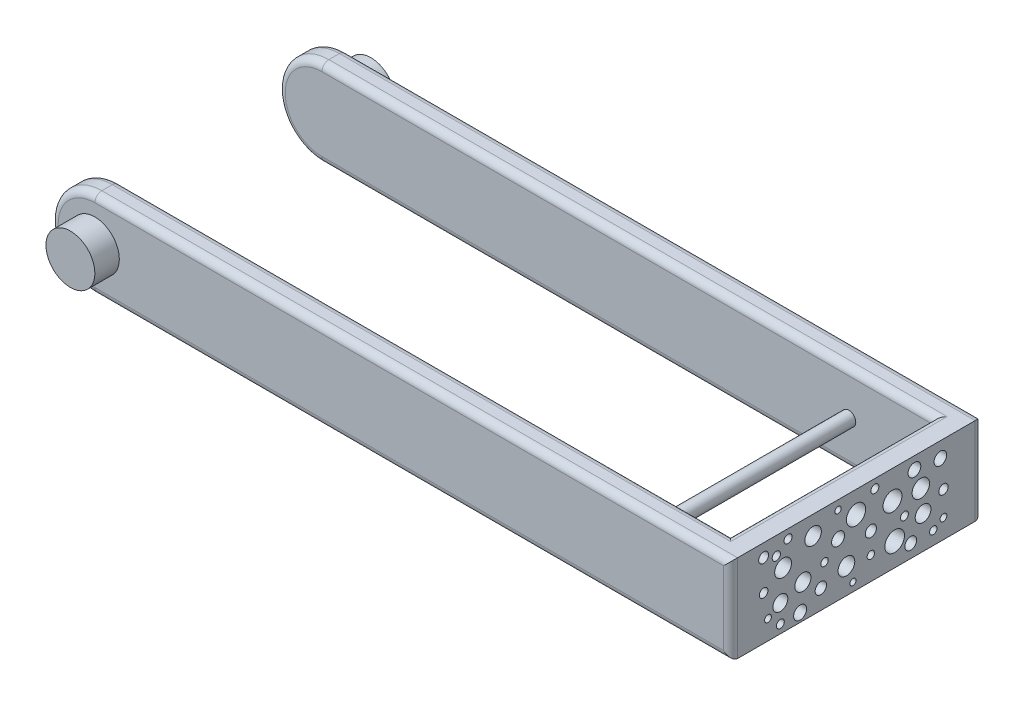
from build123d import *

# Parameters (mm, degrees)
BOSS_EXTRUDE1_DEPTH = 7
BOSS_EXTRUDE2_DEPTH = 7
SKETCH4_R           = 7
BOSS_EXTRUDE3_DEPTH = 7
SKETCH5_R           = 7
BOSS_EXTRUDE4_DEPTH = 7
SKETCH6_W           = 15.675123076
SKETCH6_H           = 25
CUT_EXTRUDE1_DEPTH  = 129.051747352
SKETCH7_W           = 72
SKETCH7_H           = 25
BOSS_EXTRUDE5_DEPTH = 7
SKETCH8_R           = 1.061370883
SKETCH8_R_2         = 1.592056325
SKETCH8_R_3         = 2.707420536
SKETCH8_R_4         = 2.754684025
SKETCH8_R_5         = 2.368943822
SKETCH8_R_6         = 2.299636914
SKETCH8_R_7         = 2.392474711
SKETCH8_R_8         = 2.815079383
SKETCH8_R_9         = 1.134575484
SKETCH8_R_10        = 1.630892674
SKETCH8_R_11        = 2.410638363
SKETCH8_R_12        = 2.139261407
SKETCH8_R_13        = 1.839257189
SKETCH8_R_14        = 1.824177684
SKETCH8_R_15        = 2.496489188
SKETCH8_R_16        = 2.252823118
SKETCH8_R_17        = 1.347918968
SKETCH8_R_18        = 1.149818457
SKETCH8_R_19        = 0.901675203
SKETCH8_R_20        = 0.884475736
SKETCH8_R_21        = 1.857399046
SKETCH8_R_22        = 1.699022407
SKETCH8_R_23        = 1.809875359
SKETCH8_R_24        = 0.975433155
SKETCH8_R_25        = 1.238266031
SKETCH8_R_26        = 1.426174271
SKETCH8_R_27        = 1.185528831
SKETCH8_R_28        = 1.125753823
CUT_EXTRUDE2_DEPTH  = 7
FILLET1_R           = 2
SKETCH9_R           = 2
BOSS_EXTRUDE6_DEPTH = 68


with BuildPart() as part:
    # Sketch1 → Boss-Extrude1 (new body)
    with BuildSketch(Plane.XY):
        with BuildLine():
            Line((-87.5, 12.5), (87.5, 12.5))
            ThreePointArc((87.5, 12.5), (100, 0), (87.5, -12.5))
            Line((87.5, -12.5), (-87.5, -12.5))
            ThreePointArc((-87.5, -12.5), (-100, 0), (-87.5, 12.5))
        make_face()
    extrude(amount=BOSS_EXTRUDE1_DEPTH)

    # Sketch5 → Boss-Extrude4 (add)
    with BuildSketch(Plane(origin=(0, 0, 0), x_dir=(-1, 0, 0), z_dir=(0, 0, -1))):
        with Locations(Location((87.5, 0, 0), (0, 0, 180))):
            Circle(SKETCH5_R)
    extrude(amount=BOSS_EXTRUDE4_DEPTH)


with BuildPart() as body_2:
    # Sketch3 → Boss-Extrude2 (new body)
    with BuildSketch(Plane.XY.offset(65)):
        with BuildLine():
            Line((-87.5, 12.5), (87.5, 12.5))
            ThreePointArc((87.5, 12.5), (100, 0), (87.5, -12.5))
            Line((87.5, -12.5), (-87.5, -12.5))
            ThreePointArc((-87.5, -12.5), (-100, 0), (-87.5, 12.5))
        make_face()
    extrude(amount=BOSS_EXTRUDE2_DEPTH)

    # Sketch4 → Boss-Extrude3 (add)
    with BuildSketch(Plane.XY.offset(72)):
        with Locations((-87.5, 0)):
            Circle(SKETCH4_R)
    extrude(amount=BOSS_EXTRUDE3_DEPTH)


with BuildPart() as cut_extrude1_tool:
    # Sketch6 → Cut-Extrude1 (new, through all)
    with BuildSketch(Plane.XY):
        with Locations((95.337561538, 0)):
            Rectangle(SKETCH6_W, SKETCH6_H)
    extrude(amount=CUT_EXTRUDE1_DEPTH)


with BuildPart() as part_1:
    add(part.part)

    # Cut-Extrude1: cut by cut_extrude1_tool
    add(cut_extrude1_tool.part, mode=Mode.SUBTRACT)



with BuildPart() as body_2_1:
    add(body_2.part)

    # Cut-Extrude1: cut by cut_extrude1_tool
    add(cut_extrude1_tool.part, mode=Mode.SUBTRACT)


with BuildPart() as part_2:
    add(part_1.part)

    add(body_2_1.part)  # Boss-Extrude5 merges body 2
    # Sketch7 → Boss-Extrude5 (add)
    with BuildSketch(Plane(origin=(87.5, 0, 0), x_dir=(0, 0, -1), z_dir=(1, 0, 0))):
        with Locations((-36, 0)):
            Rectangle(SKETCH7_W, SKETCH7_H)
    extrude(amount=BOSS_EXTRUDE5_DEPTH)

    # Sketch8 → Cut-Extrude2 (cut)
    with BuildSketch(Plane(origin=(94.5, 0, 0), x_dir=(0, 0, -1), z_dir=(1, 0, 0))):
        with Locations(Location((-45.110100082, -1.017147097, 0), (0, 0, 90))):
            Circle(SKETCH8_R)
        with Locations(Location((-31.84296404, 0.044223787, 0), (0, 0, 90))):
            Circle(SKETCH8_R_2)
        with Locations(Location((-25.651633888, 4.378154894, 0), (0, 0, 90))):
            Circle(SKETCH8_R_3)
        with Locations(Location((-36.088447574, 6.23555394, 0), (0, 0, 90))):
            Circle(SKETCH8_R_4)
        with Locations(Location((-48.382660305, 7.08557543, 0), (0, 0, 90))):
            Circle(SKETCH8_R_5)
        with Locations(Location((-51.301430235, -2.874546142, 0), (0, 0, 90))):
            Circle(SKETCH8_R_6)
        with Locations(Location((-38.843131599, -5.174183056, 0), (0, 0, 90))):
            Circle(SKETCH8_R_7)
        with Locations(Location((-25.032500872, -5.881763645, 0), (0, 0, 90))):
            Circle(SKETCH8_R_8)
        with Locations(Location((-22.21742149, -1.017147097, 0), (0, 0, 90))):
            Circle(SKETCH8_R_9)
        with Locations(Location((-31.84296404, -5.881763645, 0), (0, 0, 90))):
            Circle(SKETCH8_R)
        with Locations(Location((-46.171470965, -6.943134528, 0), (0, 0, 90))):
            Circle(SKETCH8_R_10)
        with Locations(Location((-56.962074946, 3.480869914, 0), (0, 0, 90))):
            Circle(SKETCH8_R_11)
        with Locations(Location((-57.758103108, -4.820392762, 0), (0, 0, 90))):
            Circle(SKETCH8_R_12)
        with Locations(Location((-41.23560631, 2.786098569, 0), (0, 0, 90))):
            Circle(SKETCH8_R_13)
        with Locations(Location((-19.371856161, 8.990237965, 0), (0, 0, 90))):
            Circle(SKETCH8_R_14)
        with Locations(Location((-17.547678478, 3.480869914, 0), (0, 0, 90))):
            Circle(SKETCH8_R_15)
        with Locations(Location((-16.8953241, -3.066684263, 0), (0, 0, 90))):
            Circle(SKETCH8_R_16)
        with Locations(Location((-13.976554171, -8.712086001, 0), (0, 0, 90))):
            Circle(SKETCH8_R)
        with Locations(Location((-11.057784242, 0, 0), (0, 0, 90))):
            Circle(SKETCH8_R_17)
        with Locations(Location((-30.693145583, 9.950352031, 0), (0, 0, 90))):
            Circle(SKETCH8_R_18)
        with Locations(Location((-41.23560631, 9.950352031, 0), (0, 0, 90))):
            Circle(SKETCH8_R_19)
        with Locations(Location((-55.546913768, 9.950352031, 0), (0, 0, 90))):
            Circle(SKETCH8_R_18)
        with Locations(Location((-36.97292331, -10.038799605, 0), (0, 0, 90))):
            Circle(SKETCH8_R_20)
        with Locations(Location((-52.097458397, -10.038799605, 0), (0, 0, 90))):
            Circle(SKETCH8_R_21)
        with Locations(Location((-20.433227045, -8.712086001, 0), (0, 0, 90))):
            Circle(SKETCH8_R_22)
        with Locations(Location((-11.942259978, 8.092952985, 0), (0, 0, 90))):
            Circle(SKETCH8_R_23)
        with Locations(Location((-11.057784242, -7.013063594, 0), (0, 0, 90))):
            Circle(SKETCH8_R_24)
        with Locations(Location((-62.534272083, 0.044223787, 0), (0, 0, 90))):
            Circle(SKETCH8_R_25)
        with Locations(Location((-61.296006052, -6.943134528, 0), (0, 0, 90))):
            Circle(SKETCH8_R_24)
        with Locations(Location((-62.534272083, 8.800533574, 0), (0, 0, 90))):
            Circle(SKETCH8_R_26)
        with Locations(Location((-58.907921565, 7.374359303, 0), (0, 0, 90))):
            Circle(SKETCH8_R_27)
        with Locations(Location((-57.758103108, -10.038799605, 0), (0, 0, 90))):
            Circle(SKETCH8_R_28)
    extrude(amount=-CUT_EXTRUDE2_DEPTH, mode=Mode.SUBTRACT)

    # Fillet1
    # the kernel refuses this fillet: 2 mm, written as the material it takes off along each edge
    with BuildSketch(Plane(origin=(-87.5, 12.5, 72), x_dir=(0, 0, -1), z_dir=(1, 0, 0)), Plane(origin=(99.5, -12.5, 0), x_dir=(0, 1, 0), z_dir=(-1, 0, 0)), Plane(origin=(99.5, 12.5, 0), x_dir=(0, 0, 1), z_dir=(-1, 0, 0)), Plane(origin=(-87.5, -12.5, 72), x_dir=(0, 1, 0), z_dir=(1, 0, 0))) as fillet1_piece_1:
        with BuildLine():
            CenterArc((FILLET1_R, -FILLET1_R), FILLET1_R, 90, 90)
            Line((0, -FILLET1_R), (0, 0))
            Line((0, 0), (FILLET1_R, 0))
        make_face()
    extrude(amount=187, mode=Mode.SUBTRACT)
    with BuildSketch(Plane(origin=(87.5, -12.5, 7), x_dir=(0, 1, 0), z_dir=(0, 0, 1))) as fillet1_piece_2:
        with BuildLine():
            CenterArc((FILLET1_R, -FILLET1_R), FILLET1_R, 90, 90)
            Line((0, -FILLET1_R), (0, 0))
            Line((0, 0), (FILLET1_R, 0))
        make_face()
    extrude(amount=58, mode=Mode.SUBTRACT)
    with BuildSketch(Plane(origin=(94.5, -17.5, 72), x_dir=(-1, 0, 0), z_dir=(0, 1, 0))) as fillet1_piece_3:
        with BuildLine():
            CenterArc((FILLET1_R, -FILLET1_R), FILLET1_R, 90, 90)
            Line((0, -FILLET1_R), (0, 0))
            Line((0, 0), (FILLET1_R, 0))
        make_face()
    extrude(amount=35, mode=Mode.SUBTRACT)
    with BuildSketch(Plane(origin=(94.5, 17.5, 0), x_dir=(0, 0, 1), z_dir=(0, -1, 0))) as fillet1_piece_4:
        with BuildLine():
            CenterArc((FILLET1_R, FILLET1_R), FILLET1_R, 180, 90)
            Line((0, FILLET1_R), (0, 0))
            Line((0, 0), (FILLET1_R, 0))
        make_face()
    extrude(amount=35, mode=Mode.SUBTRACT)
    with BuildSketch(Plane(origin=(-87.5, 0, 72), x_dir=(0, -1, 0), z_dir=(1, 0, 0))) as fillet1_piece_5:
        with BuildLine():
            CenterArc((12.5 - FILLET1_R, FILLET1_R), FILLET1_R, 270, 90)
            Line((12.5 - FILLET1_R, 0), (12.5, 0))
            Line((12.5, 0), (12.5, FILLET1_R))
        make_face()
    revolve(axis=Axis((-87.5, 0, 72), (0, 0, -1)), revolution_arc=180, mode=Mode.SUBTRACT)
    with BuildSketch(Plane(origin=(87.5, 12.5, 65), x_dir=(1, 0, 0), z_dir=(0, 0, -1))) as fillet1_piece_6:
        with BuildLine():
            CenterArc((FILLET1_R, FILLET1_R), FILLET1_R, 180, 90)
            Line((0, FILLET1_R), (0, 0))
            Line((0, 0), (FILLET1_R, 0))
        make_face()
    extrude(amount=58, mode=Mode.SUBTRACT)
    with BuildSketch(Plane(origin=(-87.5, 12.5, 65), x_dir=(0, 0, 1), z_dir=(1, 0, 0)), Plane(origin=(87.5, -12.5, 7), x_dir=(0, 1, 0), z_dir=(-1, 0, 0))) as fillet1_piece_7:
        with BuildLine():
            CenterArc((FILLET1_R, FILLET1_R), FILLET1_R, 180, 90)
            Line((0, FILLET1_R), (0, 0))
            Line((0, 0), (FILLET1_R, 0))
        make_face()
    extrude(amount=175, mode=Mode.SUBTRACT)
    with BuildSketch(Plane(origin=(-87.5, 12.5, 7), x_dir=(0, 0, -1), z_dir=(1, 0, 0)), Plane(origin=(87.5, -12.5, 65), x_dir=(0, 1, 0), z_dir=(-1, 0, 0))) as fillet1_piece_8:
        with BuildLine():
            CenterArc((FILLET1_R, -FILLET1_R), FILLET1_R, 90, 90)
            Line((0, -FILLET1_R), (0, 0))
            Line((0, 0), (FILLET1_R, 0))
        make_face()
    extrude(amount=175, mode=Mode.SUBTRACT)
    with BuildSketch(Plane(origin=(-87.5, 0, 7), x_dir=(0, -1, 0), z_dir=(1, 0, 0))) as fillet1_piece_9:
        with BuildLine():
            CenterArc((12.5 - FILLET1_R, FILLET1_R), FILLET1_R, 270, 90)
            Line((12.5 - FILLET1_R, 0), (12.5, 0))
            Line((12.5, 0), (12.5, FILLET1_R))
        make_face()
    revolve(axis=Axis((-87.5, 0, 7), (0, 0, -1)), revolution_arc=180, mode=Mode.SUBTRACT)
    with BuildSketch(Plane(origin=(-87.5, 0, 0), x_dir=(0, -1, 0), z_dir=(1, 0, 0))) as fillet1_piece_10:
        with BuildLine():
            CenterArc((12.5 - FILLET1_R, -FILLET1_R), FILLET1_R, 0, 90)
            Line((12.5, -FILLET1_R), (12.5, 0))
            Line((12.5, 0), (12.5 - FILLET1_R, 0))
        make_face()
    revolve(axis=Axis((-87.5, 0, 0), (0, 0, -1)), revolution_arc=180, mode=Mode.SUBTRACT)
    with BuildSketch(Plane(origin=(-87.5, 0, 65), x_dir=(0, -1, 0), z_dir=(1, 0, 0))) as fillet1_piece_11:
        with BuildLine():
            CenterArc((12.5 - FILLET1_R, -FILLET1_R), FILLET1_R, 0, 90)
            Line((12.5 - FILLET1_R, 0), (12.5, 0))
            Line((12.5, 0), (12.5, -FILLET1_R))
        make_face()
    revolve(axis=Axis((-87.5, 0, 65), (0, 0, -1)), revolution_arc=180, mode=Mode.SUBTRACT)
    with BuildSketch(Plane(origin=(92.5, -12.5, 7), x_dir=(0, 1, 0), z_dir=(-1, 0, 0))) as fillet1_piece_12a_section:
        with BuildLine():
            CenterArc((FILLET1_R, FILLET1_R), FILLET1_R, 180, 90)
            Line((0, FILLET1_R), (0, 0))
            Line((0, 0), (FILLET1_R, 0))
        make_face()
    fillet1_piece_12a = extrude(amount=180, mode=Mode.PRIVATE)
    fillet1_piece_12a = split(fillet1_piece_12a, bisect_by=Plane(origin=(87.5, -12.047209771, 6.547209771), z_dir=(1, 0, 0)), keep=Keep.TOP, mode=Mode.PRIVATE)
    with BuildSketch(Plane(origin=(87.5, -12.5, 2), x_dir=(0, 1, 0), z_dir=(0, 0, 1))) as fillet1_piece_12b_section:
        with BuildLine():
            CenterArc((FILLET1_R, -FILLET1_R), FILLET1_R, 90, 90)
            Line((0, -FILLET1_R), (0, 0))
            Line((0, 0), (FILLET1_R, 0))
        make_face()
    fillet1_piece_12b = extrude(amount=63, mode=Mode.PRIVATE)
    fillet1_piece_12b = split(fillet1_piece_12b, bisect_by=Plane(origin=(87.952790229, -12.047209771, 7), z_dir=(0, 0, -1)), keep=Keep.TOP, mode=Mode.PRIVATE)
    fillet1_piece_12 = fillet1_piece_12a & fillet1_piece_12b
    add(fillet1_piece_12, mode=Mode.SUBTRACT)
    with BuildSketch(Plane(origin=(87.5, -12.5, 7), x_dir=(0, 1, 0), z_dir=(0, 0, 1))) as fillet1_piece_13a_section:
        with BuildLine():
            CenterArc((FILLET1_R, -FILLET1_R), FILLET1_R, 90, 90)
            Line((0, -FILLET1_R), (0, 0))
            Line((0, 0), (FILLET1_R, 0))
        make_face()
    fillet1_piece_13a = extrude(amount=63, mode=Mode.PRIVATE)
    fillet1_piece_13a = split(fillet1_piece_13a, bisect_by=Plane(origin=(87.952790229, -12.047209771, 65), z_dir=(0, 0, 1)), keep=Keep.TOP, mode=Mode.PRIVATE)
    with BuildSketch(Plane(origin=(92.5, -12.5, 65), x_dir=(0, 1, 0), z_dir=(-1, 0, 0))) as fillet1_piece_13b_section:
        with BuildLine():
            CenterArc((FILLET1_R, -FILLET1_R), FILLET1_R, 90, 90)
            Line((0, -FILLET1_R), (0, 0))
            Line((0, 0), (FILLET1_R, 0))
        make_face()
    fillet1_piece_13b = extrude(amount=180, mode=Mode.PRIVATE)
    fillet1_piece_13b = split(fillet1_piece_13b, bisect_by=Plane(origin=(87.5, -12.047209771, 65.452790229), z_dir=(1, 0, 0)), keep=Keep.TOP, mode=Mode.PRIVATE)
    fillet1_piece_13 = fillet1_piece_13a & fillet1_piece_13b
    add(fillet1_piece_13, mode=Mode.SUBTRACT)
    with BuildSketch(Plane(origin=(87.5, 12.5, 70), x_dir=(1, 0, 0), z_dir=(0, 0, -1))) as fillet1_piece_14a_section:
        with BuildLine():
            CenterArc((FILLET1_R, FILLET1_R), FILLET1_R, 180, 90)
            Line((0, FILLET1_R), (0, 0))
            Line((0, 0), (FILLET1_R, 0))
        make_face()
    fillet1_piece_14a = extrude(amount=63, mode=Mode.PRIVATE)
    fillet1_piece_14a = split(fillet1_piece_14a, bisect_by=Plane(origin=(87.952790229, 12.047209771, 65), z_dir=(0, 0, 1)), keep=Keep.TOP, mode=Mode.PRIVATE)
    with BuildSketch(Plane(origin=(-87.5, 12.5, 65), x_dir=(0, 0, 1), z_dir=(1, 0, 0))) as fillet1_piece_14b_section:
        with BuildLine():
            CenterArc((FILLET1_R, FILLET1_R), FILLET1_R, 180, 90)
            Line((0, FILLET1_R), (0, 0))
            Line((0, 0), (FILLET1_R, 0))
        make_face()
    fillet1_piece_14b = extrude(amount=180, mode=Mode.PRIVATE)
    fillet1_piece_14b = split(fillet1_piece_14b, bisect_by=Plane(origin=(87.5, 12.047209771, 65.452790229), z_dir=(1, 0, 0)), keep=Keep.TOP, mode=Mode.PRIVATE)
    fillet1_piece_14 = fillet1_piece_14a & fillet1_piece_14b
    add(fillet1_piece_14, mode=Mode.SUBTRACT)
    with BuildSketch(Plane(origin=(-87.5, 12.5, 7), x_dir=(0, 0, -1), z_dir=(1, 0, 0))) as fillet1_piece_15a_section:
        with BuildLine():
            CenterArc((FILLET1_R, -FILLET1_R), FILLET1_R, 90, 90)
            Line((0, -FILLET1_R), (0, 0))
            Line((0, 0), (FILLET1_R, 0))
        make_face()
    fillet1_piece_15a = extrude(amount=180, mode=Mode.PRIVATE)
    fillet1_piece_15a = split(fillet1_piece_15a, bisect_by=Plane(origin=(87.5, 12.047209771, 6.547209771), z_dir=(1, 0, 0)), keep=Keep.TOP, mode=Mode.PRIVATE)
    with BuildSketch(Plane(origin=(87.5, 12.5, 65), x_dir=(1, 0, 0), z_dir=(0, 0, -1))) as fillet1_piece_15b_section:
        with BuildLine():
            CenterArc((FILLET1_R, FILLET1_R), FILLET1_R, 180, 90)
            Line((0, FILLET1_R), (0, 0))
            Line((0, 0), (FILLET1_R, 0))
        make_face()
    fillet1_piece_15b = extrude(amount=63, mode=Mode.PRIVATE)
    fillet1_piece_15b = split(fillet1_piece_15b, bisect_by=Plane(origin=(87.952790229, 12.047209771, 7), z_dir=(0, 0, -1)), keep=Keep.TOP, mode=Mode.PRIVATE)
    fillet1_piece_15 = fillet1_piece_15a & fillet1_piece_15b
    add(fillet1_piece_15, mode=Mode.SUBTRACT)

    # Sketch9 → Boss-Extrude6 (add)
    with BuildSketch(Plane.XY.offset(72)):
        with Locations((63.335020883, 0)):
            Circle(SKETCH9_R)
    extrude(amount=-BOSS_EXTRUDE6_DEPTH)


solid = part_2.part
